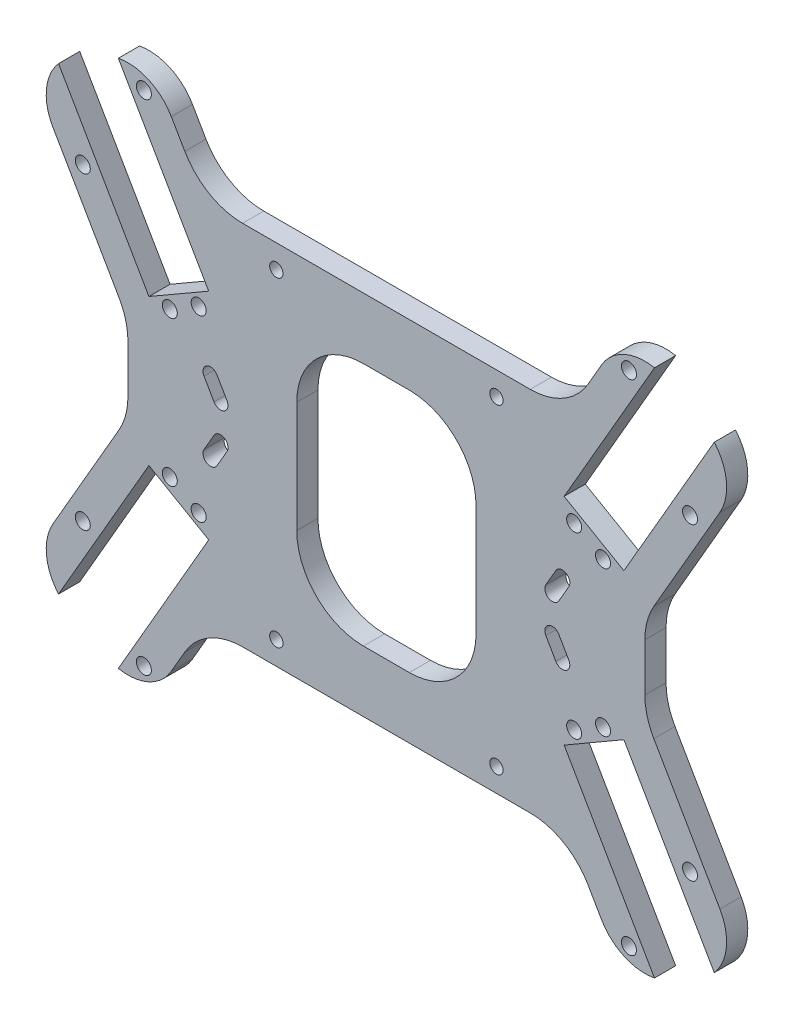
from build123d import *

# Parameters (mm, degrees)
ESQUISSE3_W                   = 53.75
ESQUISSE3_H                   = 73.333333334
BOSS_EXTRU_2_DEPTH            = 6.35
CONG_6_R                      = 20
CONG_7_R                      = 15
ESQUISSE4_R                   = 2.25
ENL_V_MAT_EXTRU_2_DEPTH       = 6.35
SYM_TRIE2_COPY_1_SKETCH_R     = 2.25
SYM_TRIE2_COPY_1_DEPTH        = 6.35
SYM_TRIE2_COPY_2_SKETCH_R     = 2.25
SYM_TRIE2_COPY_2_DEPTH        = 6.35
DIAM_TRE_DU_PER_AGE_4_0_4_1_D = 4


with BuildPart() as part:
    # Esquisse3 → Boss.-Extru.2 (new body)
    with BuildSketch(Plane.XY):
        Polygon((-54.672450369, 55), (54.672450369, 55), (71.992958445, 85), (107.5, 64.5), (77.5, 12.538475773), (77.5, -12.538475773), (107.5, -64.5), (71.992958445, -85), (54.672450369, -55), (-54.672450369, -55), (-71.992958445, -85), (-107.5, -64.5), (-77.5, -12.538475773), (-77.5, 12.538475773), (-107.5, 64.5), (-71.992958445, 85), align=None)
        Rectangle(ESQUISSE3_W, ESQUISSE3_H, mode=Mode.SUBTRACT)
    extrude(amount=-BOSS_EXTRU_2_DEPTH)

    # Congé6
    cong_6_edges = [part.edges().sort_by_distance(p)[0] for p in [
        (77.5, -12.538475773, -3.175),
        (77.5, 12.538475773, -3.175),
        (54.672450369, 55, -3.175),
        (-54.672450369, 55, -3.175),
        (-77.5, 12.538475773, -3.175),
        (-77.5, -12.538475773, -3.175),
        (-54.672450369, -55, -3.175),
        (54.672450369, -55, -3.175),
        (26.875, -36.666666667, -3.175),
        (26.875, 36.666666667, -3.175),
        (-26.875, -36.666666667, -3.175),
        (-26.875, 36.666666667, -3.175),
    ]]
    fillet(cong_6_edges, radius=CONG_6_R)

    # Congé7
    cong_7_edges = [part.edges().sort_by_distance(p)[0] for p in [
        (71.992958445, -85, -3.175),
        (107.5, -64.5, -3.175),
        (107.5, 64.5, -3.175),
        (71.992958445, 85, -3.175),
        (-71.992958445, 85, -3.175),
        (-107.5, 64.5, -3.175),
        (-71.992958445, -85, -3.175),
        (-107.5, -64.5, -3.175),
    ]]
    fillet(cong_7_edges, radius=CONG_7_R)

    # Esquisse4 → Enlèv. mat.-Extru.2 (cut)
    with BuildSketch(Plane.XY):
        with Locations((-91.039969171, 46.290390309)):
            Circle(ESQUISSE4_R)
        with Locations((-56.291352203, 26.80402023)):
            Circle(ESQUISSE4_R)
        with Locations((-64.951606241, 21.80402023)):
            Circle(ESQUISSE4_R)
        with Locations((-72.722604517, 74.763784068)):
            Circle(ESQUISSE4_R)
        Polygon((-53.283116293, 32.293602792), (-74.283116293, 68.666669751), (-80.783116293, 79.925), (-98.709842152, 69.575), (-92.209842152, 58.316669751), (-71.209842152, 21.943602792), align=None)
        with BuildLine():
            Line((-51.695036381, 4.342967697), (-54.695036381, 9.53912012))
            ThreePointArc((-54.695036381, 9.53912012), (-53.871479222, 12.612677278), (-50.797922064, 11.78912012))
            Line((-50.797922064, 11.78912012), (-47.797922064, 6.592967697))
            ThreePointArc((-47.797922064, 6.592967697), (-48.621479222, 3.519410539), (-51.695036381, 4.342967697))
        make_face()
    enl_v_mat_extru_2 = extrude(amount=-ENL_V_MAT_EXTRU_2_DEPTH, mode=Mode.SUBTRACT)

    # Symétrie1: Enlèv. mat.-Extru.2 across plane
    add(enl_v_mat_extru_2.mirror(Plane.ZX), mode=Mode.SUBTRACT)

    # Symétrie2 copy 1 sketch → Symétrie2 copy 1 (cut)
    with BuildSketch(Plane(origin=(0, 0, 0), x_dir=(-1, 0, 0), z_dir=(0, 0, 1))):
        with Locations((-91.039969171, 46.290390309)):
            Circle(SYM_TRIE2_COPY_1_SKETCH_R)
        with Locations((-56.291352203, 26.80402023)):
            Circle(SYM_TRIE2_COPY_1_SKETCH_R)
        with Locations((-64.951606241, 21.80402023)):
            Circle(SYM_TRIE2_COPY_1_SKETCH_R)
        with Locations((-72.722604517, 74.763784068)):
            Circle(SYM_TRIE2_COPY_1_SKETCH_R)
        Polygon((-53.283116293, 32.293602792), (-74.283116293, 68.666669751), (-80.783116293, 79.925), (-98.709842152, 69.575), (-92.209842152, 58.316669751), (-71.209842152, 21.943602792), align=None)
        with BuildLine():
            Line((-51.695036381, 4.342967697), (-54.695036381, 9.53912012))
            ThreePointArc((-54.695036381, 9.53912012), (-53.871479222, 12.612677278), (-50.797922064, 11.78912012))
            Line((-50.797922064, 11.78912012), (-47.797922064, 6.592967697))
            ThreePointArc((-47.797922064, 6.592967697), (-48.621479222, 3.519410539), (-51.695036381, 4.342967697))
        make_face()
    extrude(amount=-SYM_TRIE2_COPY_1_DEPTH, mode=Mode.SUBTRACT)

    # Symétrie2 copy 2 sketch → Symétrie2 copy 2 (cut)
    with BuildSketch(Plane(origin=(0, 0, 0), x_dir=(-1, 0, 0), z_dir=(0, 0, 1))):
        with Locations((-91.039969171, -46.290390309)):
            Circle(SYM_TRIE2_COPY_2_SKETCH_R)
        with Locations((-56.291352203, -26.80402023)):
            Circle(SYM_TRIE2_COPY_2_SKETCH_R)
        with Locations((-64.951606241, -21.80402023)):
            Circle(SYM_TRIE2_COPY_2_SKETCH_R)
        with Locations((-72.722604517, -74.763784068)):
            Circle(SYM_TRIE2_COPY_2_SKETCH_R)
        Polygon((-53.283116293, -32.293602792), (-74.283116293, -68.666669751), (-80.783116293, -79.925), (-98.709842152, -69.575), (-92.209842152, -58.316669751), (-71.209842152, -21.943602792), align=None)
        with BuildLine():
            Line((-51.695036381, -4.342967697), (-54.695036381, -9.53912012))
            ThreePointArc((-54.695036381, -9.53912012), (-53.871479222, -12.612677278), (-50.797922064, -11.78912012))
            Line((-50.797922064, -11.78912012), (-47.797922064, -6.592967697))
            ThreePointArc((-47.797922064, -6.592967697), (-48.621479222, -3.519410539), (-51.695036381, -4.342967697))
        make_face()
    extrude(amount=-SYM_TRIE2_COPY_2_DEPTH, mode=Mode.SUBTRACT)

    # Diamètre du perçage Ø4.0 (4)1 (through all)
    with Locations(Plane.XY):
        with Locations((33, 48), (-33, 48), (-33, -48), (33, -48)):
            Hole(DIAM_TRE_DU_PER_AGE_4_0_4_1_D / 2)


solid = part.part
